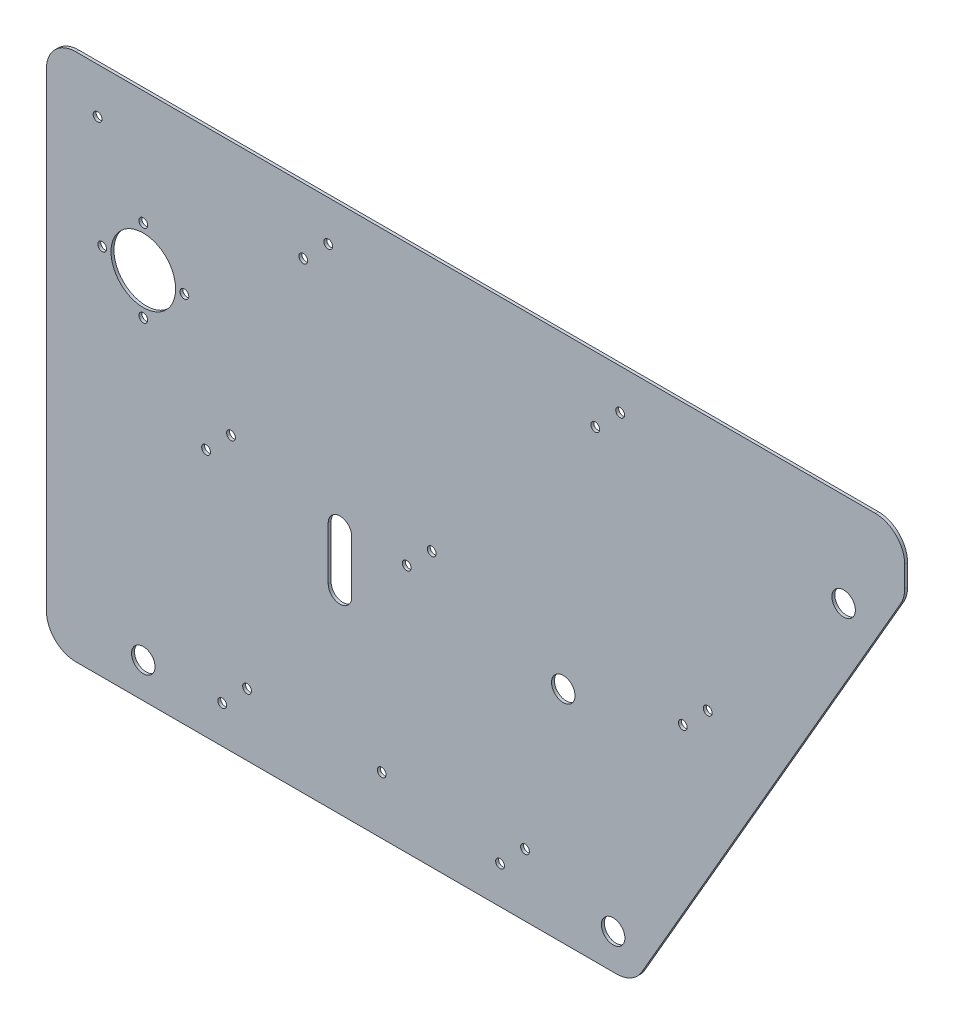
from build123d import *

# Parameters (mm, degrees)
BOSS_EXTRUDE1_DEPTH = 1
FILLET1_R           = 10
SKETCH2_R           = 4
SKETCH2_R_2         = 11
SKETCH2_R_3         = 1.5
CUT_EXTRUDE1_DEPTH  = 3


with BuildPart() as part:
    # Sketch1 → Boss-Extrude1 (new body)
    with BuildSketch(Plane.XY):
        Polygon((-100, 100), (-100, -80), (100, -80), (192.37604307, 80), (192.37604307, 100), align=None)
    extrude(amount=BOSS_EXTRUDE1_DEPTH)

    # Fillet1
    fillet1_edges = [part.edges().sort_by_distance(p)[0] for p in [
        (100, -80, 0.5),
        (-100, -80, 0.5),
        (192.37604307, 100, 0.5),
        (192.37604307, 80, 0.5),
        (-100, 100, 0.5),
    ]]
    fillet(fillet1_edges, radius=FILLET1_R)

    # Sketch2 → Cut-Extrude1 (cut)
    with BuildSketch(Plane.XY.offset(1)):
        with Locations((93.07179677, -68)):
            Circle(SKETCH2_R)
        with Locations((171.59143338, 68)):
            Circle(SKETCH2_R)
        with Locations((-67, 47)):
            Circle(SKETCH2_R_2)
        with Locations((-67, -68)):
            Circle(SKETCH2_R)
        with Locations((-53, 47)):
            Circle(SKETCH2_R_3)
        with Locations((-67, 61)):
            Circle(SKETCH2_R_3)
        with Locations((-81, 47)):
            Circle(SKETCH2_R_3)
        with Locations((-67, 33)):
            Circle(SKETCH2_R_3)
        with Locations((76.08145631, -5)):
            Circle(SKETCH2_R)
        with Locations((54.54952947, -67.242640687)):
            Circle(SKETCH2_R_3)
        with Locations((63.034810844, -58.757359313)):
            Circle(SKETCH2_R_3)
        with Locations((14.225855729, -60.5)):
            Circle(SKETCH2_R_3)
        with Locations((-40.127135228, -67.242640687)):
            Circle(SKETCH2_R_3)
        with Locations((-31.641853854, -58.757359313)):
            Circle(SKETCH2_R_3)
        with Locations((-82.576317869, 84.5)):
            Circle(SKETCH2_R_3)
        with Locations((-12.482801161, 77.757359313)):
            Circle(SKETCH2_R_3)
        with Locations((-3.997519787, 86.242640687)):
            Circle(SKETCH2_R_3)
        with Locations((86.965374539, 77.757359313)):
            Circle(SKETCH2_R_3)
        with Locations((95.450655913, 86.242640687)):
            Circle(SKETCH2_R_3)
        with Locations((22.762645068, 4.757359313)):
            Circle(SKETCH2_R_3)
        with Locations((31.247926442, 13.242640687)):
            Circle(SKETCH2_R_3)
        with Locations((-45.601368119, 4.757359313)):
            Circle(SKETCH2_R_3)
        with Locations((-37.116086745, 13.242640687)):
            Circle(SKETCH2_R_3)
        with Locations((116.811272287, 4.757359313)):
            Circle(SKETCH2_R_3)
        with Locations((125.296553661, 13.242640687)):
            Circle(SKETCH2_R_3)
        with BuildLine():
            Line((-4, -14), (-4, 4))
            ThreePointArc((-4, 4), (0, 8), (4, 4))
            Line((4, 4), (4, -14))
            ThreePointArc((4, -14), (0, -18), (-4, -14))
        make_face()
    extrude(amount=-CUT_EXTRUDE1_DEPTH, mode=Mode.SUBTRACT)


solid = part.part
